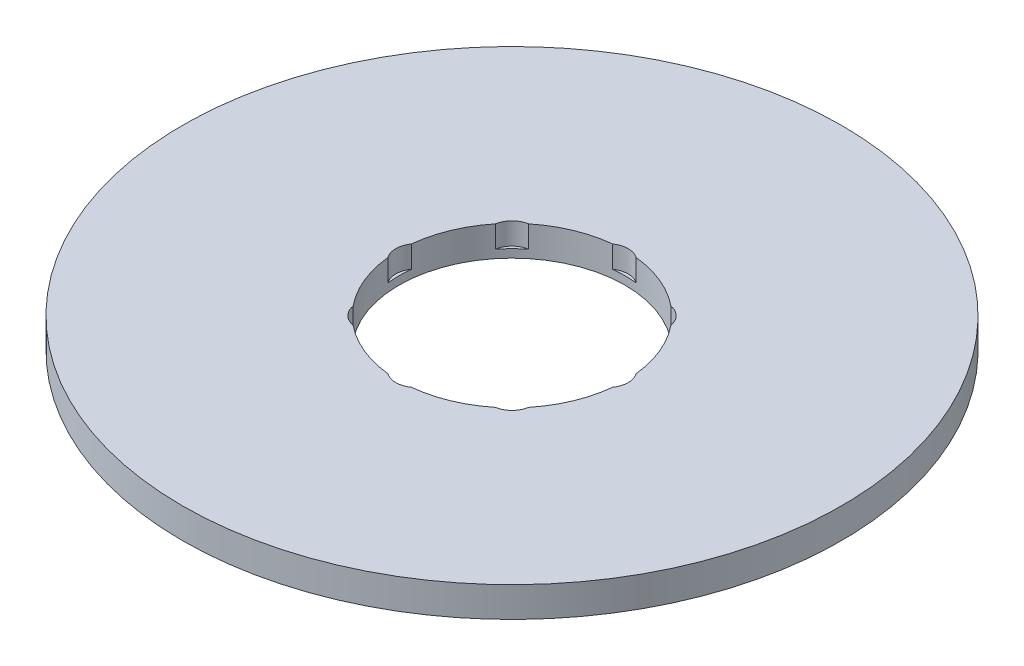
from build123d import *

# Parameters (mm, degrees)
SKETCH1_R           = 87.5
BOSS_EXTRUDE1_DEPTH = 8
SKETCH2_R           = 30
CUT_EXTRUDE1_DEPTH  = 125.002016113
SKETCH3_R           = 5.356744443
CUT_EXTRUDE2_DEPTH  = 5.826096891
CIRPATTERN1_COUNT   = 8


with BuildPart() as part:
    # Sketch1 → Boss-Extrude1 (new body)
    with BuildSketch(Plane(origin=(0, 0, 0), x_dir=(1, 0, 0), z_dir=(0, 1, 0))):
        Circle(SKETCH1_R)
    extrude(amount=BOSS_EXTRUDE1_DEPTH)

    # Sketch2 → Cut-Extrude1 (cut, through all)
    with BuildSketch(Plane(origin=(0, 0, 0), x_dir=(1, 0, 0), z_dir=(0, 1, 0))):
        Circle(SKETCH2_R)
    extrude(amount=CUT_EXTRUDE1_DEPTH, mode=Mode.SUBTRACT)

    # Sketch3 → Cut-Extrude2 (cut)
    with BuildSketch(Plane(origin=(0, 8, 0), x_dir=(1, 0, 0), z_dir=(0, 1, 0))):
        with Locations((-25.47528954, 0)):
            Circle(SKETCH3_R)
    cut_extrude2 = extrude(amount=-CUT_EXTRUDE2_DEPTH, mode=Mode.SUBTRACT)

    # CirPattern1: Cut-Extrude2 ×8 about axis
    cirpattern1_axis = Axis((0, 0, 0), (0, 1, 0))
    for i in range(1, CIRPATTERN1_COUNT):
        add(cut_extrude2.rotate(cirpattern1_axis, i * 360 / CIRPATTERN1_COUNT), mode=Mode.SUBTRACT)


solid = part.part
